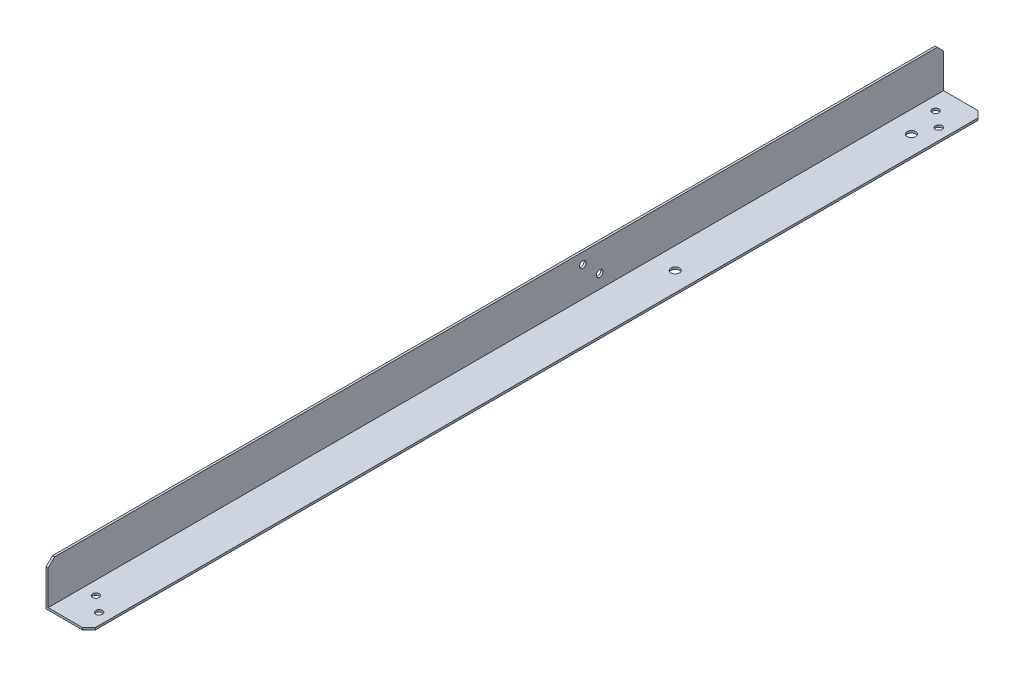
from build123d import *

# Parameters (mm, degrees)
BASE_DEPTH          = 417
CHAMFER1_SIZE       = 3
SKETCH3_R           = 1.55
FORCABLECHAIN_DEPTH = 10
SKETCH4_R           = 1.55
GUIDEHOLES_DEPTH    = 418.958131874
SKETCH5_R           = 2
CABLETIEHOLES_DEPTH = 418.958131874


with BuildPart() as part:
    # Sketch1 → Base (new body)
    with BuildSketch(Plane.XY):
        Polygon((0, 0), (20, 0), (20, 1), (1, 1), (1, 20), (0, 20), align=None)
    extrude(amount=BASE_DEPTH)

    # Chamfer1
    chamfer1_edges = [part.edges().sort_by_distance(p)[0] for p in [
        (20, 0.5, 417),
        (0.5, 20, 417),
        (0.5, 20, 0),
        (20, 0.5, 0),
    ]]
    chamfer(chamfer1_edges, length=CHAMFER1_SIZE)

    # Sketch3 → ForCableChain (cut)
    with BuildSketch(Plane(origin=(1, 0, 0), x_dir=(0, 0, -1), z_dir=(1, 0, 0))):
        with Locations((-168, 14.85)):
            Circle(SKETCH3_R)
        with Locations((-160.2, 7.35)):
            Circle(SKETCH3_R)
    extrude(amount=-FORCABLECHAIN_DEPTH, mode=Mode.SUBTRACT)

    # Sketch4 → GuideHoles (cut, through all)
    with BuildSketch(Plane.XZ):
        with Locations((7.25, 10)):
            Circle(SKETCH4_R)
        with Locations((14.75, 16)):
            Circle(SKETCH4_R)
        with Locations((7.25, 401)):
            Circle(SKETCH4_R)
        with Locations((14.75, 407)):
            Circle(SKETCH4_R)
    extrude(amount=-GUIDEHOLES_DEPTH, mode=Mode.SUBTRACT)

    # Sketch5 → CableTieHoles (cut, through all)
    with BuildSketch(Plane.XZ):
        with Locations((11, 25)):
            Circle(SKETCH5_R)
        with Locations((11, 135)):
            Circle(SKETCH5_R)
    extrude(amount=-CABLETIEHOLES_DEPTH, mode=Mode.SUBTRACT)


solid = part.part
